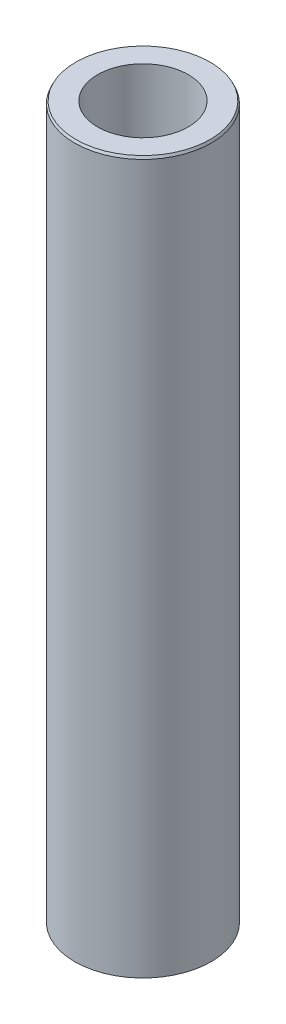
from build123d import *
from OCP.BRepFilletAPI import BRepFilletAPI_MakeChamfer

# Parameters (mm, degrees)
SKETCH1_R           = 57.5
BOSS_EXTRUDE1_DEPTH = 600
SKETCH2_R           = 38.186562081
CUT_EXTRUDE1_DEPTH  = 606.485342515
CHAMFER1_SIZE       = 2.123260872
CHAMFER1_SIZE2      = 1.003535122


with BuildPart() as part:
    # Sketch1 → Boss-Extrude1 (new body)
    with BuildSketch(Plane(origin=(0, 0, 0), x_dir=(1, 0, 0), z_dir=(0, 1, 0))):
        Circle(SKETCH1_R)
    extrude(amount=BOSS_EXTRUDE1_DEPTH)

    # Sketch2 → Cut-Extrude1 (cut, through all)
    with BuildSketch(Plane(origin=(0, 0, 0), x_dir=(1, 0, 0), z_dir=(0, 1, 0))):
        Circle(SKETCH2_R)
    extrude(amount=CUT_EXTRUDE1_DEPTH, mode=Mode.SUBTRACT)

    # Chamfer1: one chamfer whose edges measure the first distance from different faces: ONE call of the kernel's chamfer builder (chamfer() names one face for all edges)
    chamfer1_edges_1 = [part.edges().sort_by_distance(p)[0] for p in [
        (-57.5, 600, 0),
    ]]
    chamfer1_side_1 = [part.faces().sort_by_distance(p)[0] for p in [
        (-57.5, 300, 0),
    ]]
    chamfer1_edges_2 = [part.edges().sort_by_distance(p)[0] for p in [
        (-57.5, 0, 0),
    ]]
    chamfer1_side_2 = [part.faces().sort_by_distance(p)[0] for p in [
        (-55.873654403, 0, 0),
    ]]
    chamfer1 = BRepFilletAPI_MakeChamfer(part.part.solid().wrapped)
    for e in chamfer1_edges_1:
        chamfer1.Add(CHAMFER1_SIZE, CHAMFER1_SIZE2, e.wrapped, chamfer1_side_1[0].wrapped)  # the first distance lies on this face
    for e in chamfer1_edges_2:
        chamfer1.Add(CHAMFER1_SIZE, CHAMFER1_SIZE2, e.wrapped, chamfer1_side_2[0].wrapped)  # the first distance lies on this face
    add(Compound.cast(chamfer1.Shape()), mode=Mode.REPLACE)


solid = part.part
